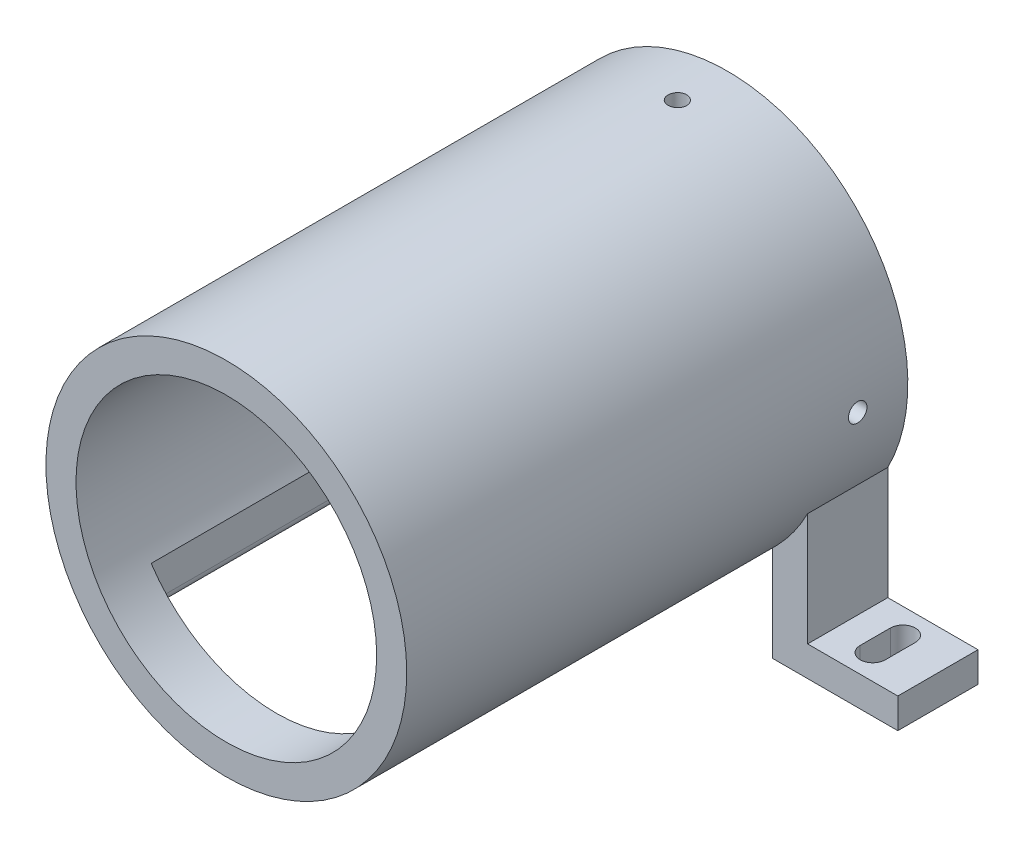
from build123d import *

# Parameters (mm, degrees)
SKETCH1_R                = 18
SKETCH1_R_2              = 15
BOSS_EXTRUDE1_DEPTH      = 50
SKETCH2_W                = 50
SKETCH2_H                = 8
BOSS_EXTRUDE2_DEPTH      = 3
BOSS_EXTRUDE5_REACH      = 69.315
BOSS_EXTRUDE5_END_RADIUS = 18
SKETCH9_W                = 32
SKETCH9_H                = 8
SKETCH4_W                = 37
SKETCH4_H                = 10
CUT_EXTRUDE1_DEPTH       = 75.204110398
CUT_EXTRUDE2_REACH       = 71.031
CUT_EXTRUDE2_END_RADIUS  = 15
SKETCH6_W                = 25
SKETCH6_H                = 45
FILLET1_R                = 1
CUT_EXTRUDE3_REACH       = 62.26
CUT_EXTRUDE3_END_RADIUS  = 18
SKETCH7_R                = 0.925
CIRPATTERN1_START        = 14.971451916
CIRPATTERN1_OUTLINE_R    = 0.925
CIRPATTERN1_DEPTH        = 3.028548184
CIRPATTERN1_START_2      = 14.9714519
CIRPATTERN1_2_OUTLINE_R  = 0.925
CIRPATTERN1_2_DEPTH      = 3.028548184


# Read off the part's stored shape, not the designer's step: CirPattern1
with BuildPart() as part:
    # Sketch1 → Boss-Extrude1 (new body)
    with BuildSketch(Plane.XY):
        Circle(SKETCH1_R)
        Circle(SKETCH1_R_2, mode=Mode.SUBTRACT)
    extrude(amount=BOSS_EXTRUDE1_DEPTH)



with BuildPart() as body_2:
    # Sketch2 → Boss-Extrude2 (new body)
    with BuildSketch(Plane(origin=(0, -22.5, 0), x_dir=(1, 0, 0), z_dir=(0, 1, 0))):
        with Locations((0, -4)):
            Rectangle(SKETCH2_W, SKETCH2_H)
        with BuildLine():
            Line((21.25, -2.5), (21.25, -5.5))
            ThreePointArc((21.25, -5.5), (20, -6.75), (18.75, -5.5))
            Line((18.75, -5.5), (18.75, -2.5))
            ThreePointArc((18.75, -2.5), (20, -1.25), (21.25, -2.5))
        make_face(mode=Mode.SUBTRACT)
        with BuildLine():
            Line((-21.25, -2.5), (-21.25, -5.5))
            ThreePointArc((-21.25, -5.5), (-20, -6.75), (-18.75, -5.5))
            Line((-18.75, -5.5), (-18.75, -2.5))
            ThreePointArc((-18.75, -2.5), (-20, -1.25), (-21.25, -2.5))
        make_face(mode=Mode.SUBTRACT)
    extrude(amount=BOSS_EXTRUDE2_DEPTH)


with BuildPart() as part_1:
    add(part.part)

    add(body_2.part)  # Boss-Extrude5 merges body 2
    # Boss-Extrude5: up to this cylinder (the profile starts outside it)
    boss_extrude5_end = Plane(origin=(0, 0, 4), z_dir=(0, 0, -1)) * Cylinder(BOSS_EXTRUDE5_END_RADIUS, 175.63, mode=Mode.PRIVATE)
    # Sketch9 → Boss-Extrude5 (add, up to the surface)
    with BuildSketch(Plane(origin=(0, -19.5, 0), x_dir=(1, 0, 0), z_dir=(0, 1, 0)), mode=Mode.PRIVATE) as boss_extrude5_sk1:
        with Locations((0, -4)):
            Rectangle(SKETCH9_W, SKETCH9_H)
    boss_extrude5_tool1 = extrude(boss_extrude5_sk1.sketch, amount=BOSS_EXTRUDE5_REACH, mode=Mode.PRIVATE) - boss_extrude5_end
    add(boss_extrude5_tool1.solids().sort_by_distance((0, -19.5, 4))[0])

    # Sketch4 → Cut-Extrude1 (cut, through all)
    with BuildSketch(Plane.ZY.offset(25)):
        with Locations((26.5, -17.5)):
            Rectangle(SKETCH4_W, SKETCH4_H)
    extrude(amount=-CUT_EXTRUDE1_DEPTH, mode=Mode.SUBTRACT)

    # Cut-Extrude2: up to this cylinder (the profile starts outside it)
    cut_extrude2_end = Plane(origin=(0, 0, 22.5), z_dir=(0, 0, -1)) * Cylinder(CUT_EXTRUDE2_END_RADIUS, 173.062, mode=Mode.PRIVATE)
    # Sketch6 → Cut-Extrude2 (cut, up to the surface)
    with BuildSketch(Plane.XZ.offset(22.5), mode=Mode.PRIVATE) as cut_extrude2_sk1:
        with Locations((0, 22.5)):
            Rectangle(SKETCH6_W, SKETCH6_H)
    cut_extrude2_tool1 = extrude(cut_extrude2_sk1.sketch, amount=-CUT_EXTRUDE2_REACH, mode=Mode.PRIVATE) - cut_extrude2_end
    add(cut_extrude2_tool1.solids().sort_by_distance((0, -22.5, 22.5))[0], mode=Mode.SUBTRACT)

    # Fillet1
    # the kernel refuses this fillet: 1 mm, written as the material it takes off along each edge
    with BuildSketch(Plane(origin=(-12.5, -12.5, 8), x_dir=(-1.0, 1.3760033648058773e-12, 0), z_dir=(0, 0, 1)), Plane(origin=(12.5, -12.5, 45), x_dir=(1.0, 1.3602776120652602e-12, 0), z_dir=(0, 0, -1))) as fillet1_piece_1:
        with BuildLine():
            CenterArc((1, -0.836369457), FILLET1_R, 123.241294146, 56.758705854)
            Line((0, -0.836369457), (-0.02, -0.836369457))
            Line((-0.02, -0.836369457), (-0.02, 0))
            Line((-0.02, 0), (0, 0.02))
            ThreePointArc((0, 0.02), (0.225916923, 0.02), (0.440870524, 0.016727389))
            Line((0.440870524, 0.016727389), (0.451833847, 0))
        make_face()
    extrude(amount=37, mode=Mode.SUBTRACT)

    # Cut-Extrude3: up to this cylinder (the profile starts inside it)
    cut_extrude3_end = Plane(origin=(0, 0, 5), z_dir=(0, 0, -1)) * Cylinder(CUT_EXTRUDE3_END_RADIUS, 161.52, mode=Mode.PRIVATE)
    # Sketch7 → Cut-Extrude3 (cut, up to the surface)
    with BuildSketch(Plane(origin=(0, 0, 0), x_dir=(0, 0, -1), z_dir=(1, 0, 0)), mode=Mode.PRIVATE) as cut_extrude3_sk1:
        with Locations((-5, 0)):
            Circle(SKETCH7_R)
    cut_extrude3_tool1 = extrude(cut_extrude3_sk1.sketch, amount=-CUT_EXTRUDE3_REACH, mode=Mode.PRIVATE) & cut_extrude3_end
    add(cut_extrude3_tool1.solids().sort_by_distance((0, 0, 5))[0], mode=Mode.SUBTRACT)

    # CirPattern1 outline → CirPattern1 (cut)
    with BuildSketch(Plane.YZ.offset(CIRPATTERN1_START)):
        with Locations((0, 5)):
            Circle(CIRPATTERN1_OUTLINE_R)
    extrude(amount=CIRPATTERN1_DEPTH, mode=Mode.SUBTRACT)

    # CirPattern1 2 outline → CirPattern1 2 (cut)
    with BuildSketch(Plane(origin=(0, 0, 0), x_dir=(1, 0, 0), z_dir=(0, 1, 0)).offset(CIRPATTERN1_START_2)):
        with Locations((0, -5)):
            Circle(CIRPATTERN1_2_OUTLINE_R)
    extrude(amount=CIRPATTERN1_2_DEPTH, mode=Mode.SUBTRACT)


solid = part_1.part
